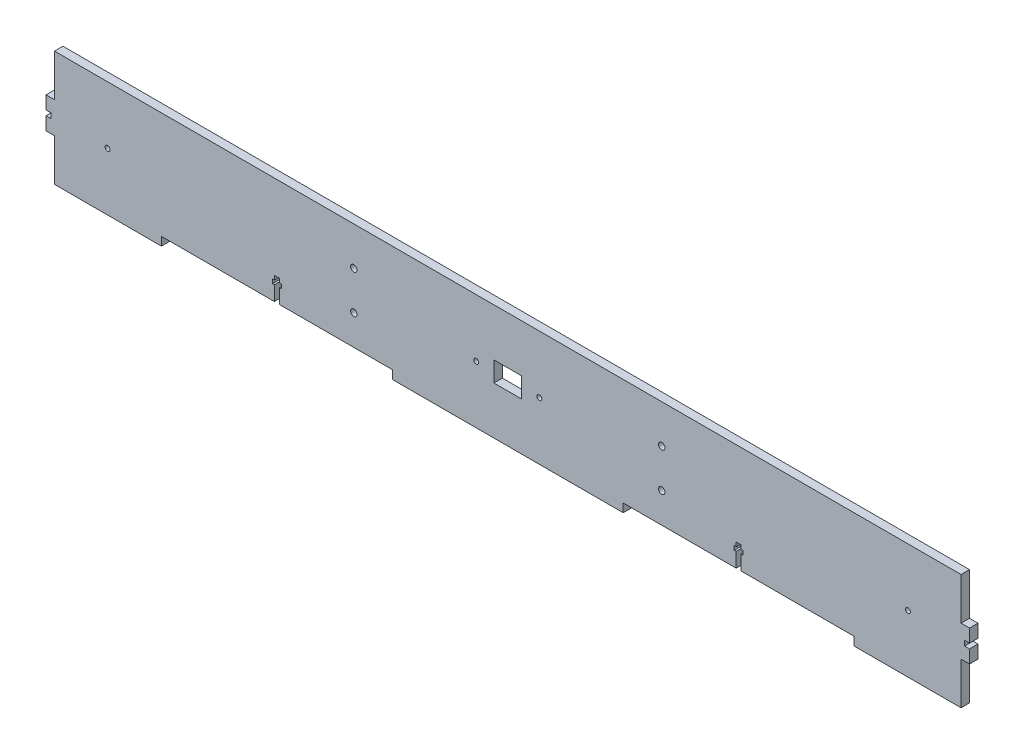
from build123d import *

# Parameters (mm, degrees)
BOSS_EXTRUDE1_DEPTH     = 5.5
CUT_EXTRUDE1_DEPTH      = 907.379197687
CUT_EXTRUDE1_DEPTH_BACK = 907.379197687
SKETCH2_R               = 1.6
SKETCH2_W               = 18
SKETCH2_H               = 13
SKETCH3_R               = 2.1
CUT_EXTRUDE2_DEPTH      = 907.379197687
SKETCH4_R               = 1.6
CUT_EXTRUDE3_DEPTH      = 907.379197687


with BuildPart() as part:
    # Sketch1 → Boss-Extrude1 (new body)
    with BuildSketch(Plane.XY):
        Polygon((308.5, 78), (308.5, 50.625), (303, 50.625), (303, 42.125), (306.25, 42.125), (306.25, 40.5), (306.25, 38.875), (303, 38.875), (303, 30.375), (308.5, 30.375), (308.5, 3), (378, 3), (378, 8.5), (451.375, 8.5), (451.375, 17.95), (450.125, 17.95), (450.125, 20.6), (451.375, 20.6), (451.375, 23.25), (454.625, 23.25), (454.625, 20.6), (455.875, 20.6), (455.875, 17.95), (454.625, 17.95), (454.625, 8.5), (528, 8.5), (528, 3), (678, 3), (678, 8.5), (751.375, 8.5), (751.375, 17.95), (750.125, 17.95), (750.125, 20.6), (751.375, 20.6), (751.375, 23.25), (754.625, 23.25), (754.625, 20.6), (755.875, 20.6), (755.875, 17.95), (754.625, 17.95), (754.625, 8.5), (828, 8.5), (828, 3), (897.5, 3), (897.5, 30.375), (903, 30.375), (903, 38.875), (899.75, 38.875), (899.75, 40.5), (899.75, 42.125), (903, 42.125), (903, 50.625), (897.5, 50.625), (897.5, 78), align=None)
    extrude(amount=BOSS_EXTRUDE1_DEPTH)

    # Sketch2 → Cut-Extrude1 (cut, two sides: drawn at the far end of the back side and taken through both)
    with BuildSketch(Plane.XY.offset(5.5).offset(-CUT_EXTRUDE1_DEPTH_BACK)):
        with Locations((623.5, 40.5)):
            Circle(SKETCH2_R)
        with Locations((603, 40.5)):
            Rectangle(SKETCH2_W, SKETCH2_H)
        with Locations((582.5, 40.5)):
            Circle(SKETCH2_R)
    extrude(amount=CUT_EXTRUDE1_DEPTH + CUT_EXTRUDE1_DEPTH_BACK, mode=Mode.SUBTRACT)

    # Sketch3 → Cut-Extrude2 (cut, through all)
    with BuildSketch(Plane.XY.offset(5.5)):
        with Locations((503, 53)):
            Circle(SKETCH3_R)
        with Locations((503, 28)):
            Circle(SKETCH3_R)
        with Locations((703, 28)):
            Circle(SKETCH3_R)
        with Locations((703, 53)):
            Circle(SKETCH3_R)
    extrude(amount=-CUT_EXTRUDE2_DEPTH, mode=Mode.SUBTRACT)

    # Sketch4 → Cut-Extrude3 (cut, through all)
    with BuildSketch(Plane.XY.offset(5.5)):
        with Locations((343, 40.5)):
            Circle(SKETCH4_R)
        with Locations((863, 40.5)):
            Circle(SKETCH4_R)
    extrude(amount=-CUT_EXTRUDE3_DEPTH, mode=Mode.SUBTRACT)


solid = part.part
